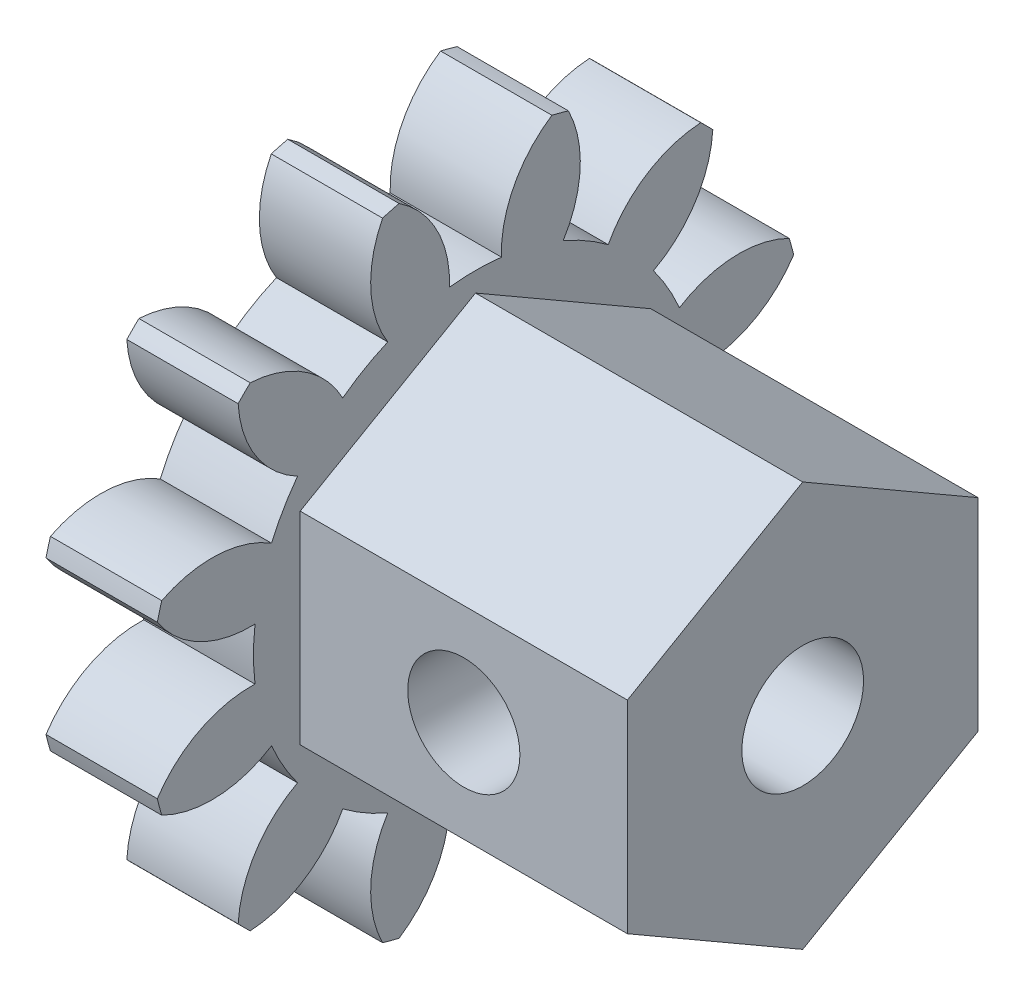
from build123d import *

# Parameters (mm, degrees)
BASPROSKE_W         = 4.7625
BASPROSKE_H         = 14
TOOTHCUT_DEPTH      = 21.36372771
TEETHCUTS_COUNT     = 12
TEETHCUTS_ANGLE     = 330
BORSKE_R            = 2.6035
BORE_DEPTH          = 50.0000508
BOSS_EXTRUDE1_DEPTH = 13.99999994
SKETCH2_R           = 2.6035
CUT_EXTRUDE1_DEPTH  = 27.882327142
SKETCH3_R           = 2.4
CUT_EXTRUDE2_DEPTH  = 32.354499992


with BuildPart() as part:
    # BasProSke → Base-Revolve (revolve)
    with BuildSketch(Plane(origin=(0, 0, 0), x_dir=(1, 0, 0), z_dir=(0, 1, 0))):
        with Locations((2.38125, 7)):
            Rectangle(BASPROSKE_W, BASPROSKE_H)
    revolve(axis=Axis((-10, 0, 0), (1, 0, 0)))

    # TooCutSke → ToothCut (cut, through all)
    with BuildSketch(Plane(origin=(0, 0, 0), x_dir=(0, 0, -1), z_dir=(1, 0, 0))):
        with BuildLine():
            ThreePointArc((1.111908866, 9.433698091), (0, 9.499), (-1.111908866, 9.433698091))
            ThreePointArc((-1.111908866, 9.433698091), (-1.651516138, 11.821129337), (-3.298149691, 13.632096456))
            ThreePointArc((-3.298149691, 13.632096456), (0, 14.0254), (3.298149691, 13.632096456))
            ThreePointArc((3.298149691, 13.632096456), (1.651516138, 11.821129337), (1.111908866, 9.433698091))
        make_face()
    toothcut = extrude(amount=TOOTHCUT_DEPTH, mode=Mode.SUBTRACT)

    # TeethCuts: ToothCut ×12 about axis
    teethcuts_axis = Axis((-10, 0, 0), (1, 0, 0))
    for i in range(1, TEETHCUTS_COUNT):
        add(toothcut.rotate(teethcuts_axis, i * TEETHCUTS_ANGLE / (TEETHCUTS_COUNT - 1)), mode=Mode.SUBTRACT)

    # BorSke → Bore (cut, symmetric)
    with BuildSketch(Plane(origin=(0, 0, 0), x_dir=(0, 0, -1), z_dir=(1, 0, 0))):
        Circle(BORSKE_R)
    extrude(amount=BORE_DEPTH, both=True, mode=Mode.SUBTRACT)

    # Sketch1 → Boss-Extrude1 (add)
    with BuildSketch(Plane(origin=(4.7625, 0, 0), x_dir=(0, 0, -1), z_dir=(1, 0, 0))):
        Polygon((0, 8.660254038), (-7.5, 4.330127019), (-7.5, -4.330127019), (0, -8.660254038), (7.5, -4.330127019), (7.5, 4.330127019), align=None)
    extrude(amount=BOSS_EXTRUDE1_DEPTH)

    # Sketch2 → Cut-Extrude1 (cut, through all)
    with BuildSketch(Plane(origin=(18.76249994, 0, 0), x_dir=(0, 0, -1), z_dir=(1, 0, 0))):
        Circle(SKETCH2_R)
    extrude(amount=-CUT_EXTRUDE1_DEPTH, mode=Mode.SUBTRACT)

    # Sketch3 → Cut-Extrude2 (cut, through all)
    with BuildSketch(Plane.XY.offset(7.5)):
        with Locations((11.76249997, 0)):
            Circle(SKETCH3_R)
    extrude(amount=-CUT_EXTRUDE2_DEPTH, mode=Mode.SUBTRACT)


solid = part.part
